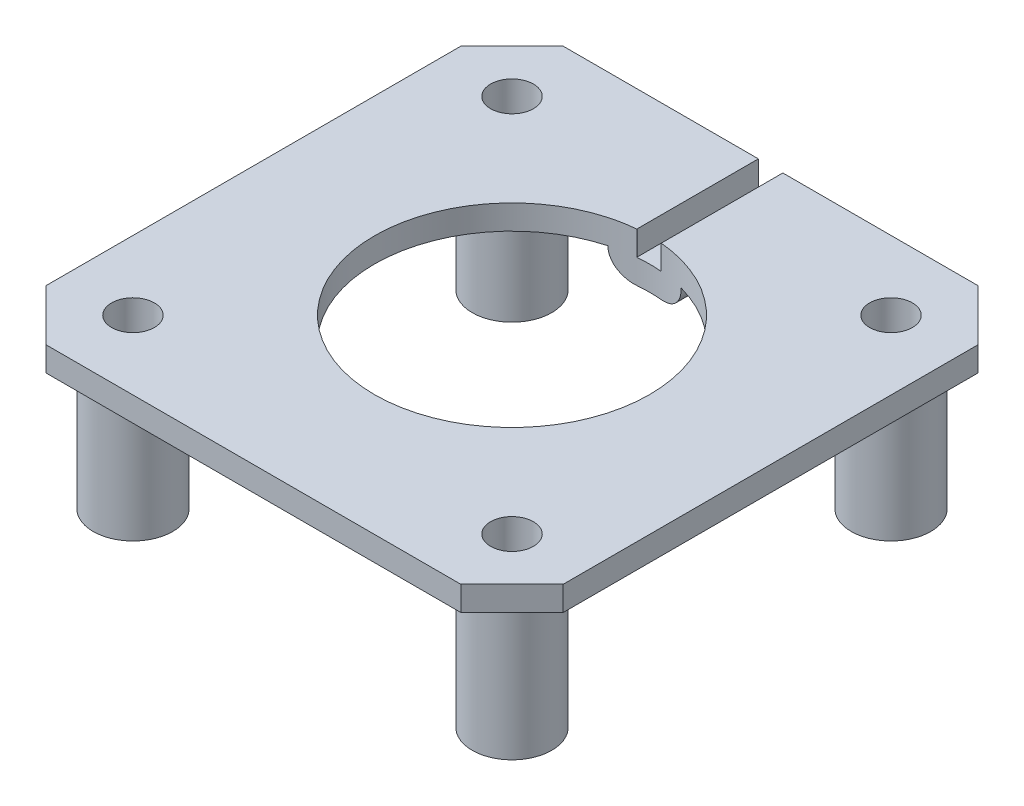
from build123d import *
from build123d.topology import SkipClean

# Parameters (mm, degrees)
SKETCH1_R               = 3.25
BOSS_EXTRUDE1_DEPTH     = 13.7
SKETCH2_W               = 42.3
SKETCH2_H               = 42.3
SKETCH2_R               = 11.25
BOSS_EXTRUDE2_DEPTH     = 2
CUT_EXTRUDE1_DEPTH      = 33.898860163
SKETCH4_R               = 1.75
CUT_EXTRUDE2_DEPTH      = 33.898860163
MIRROR6_COPY_1_SKETCH_R = 1.75
MIRROR6_COPY_1_DEPTH    = 33.898860163
BOSS_EXTRUDE3_DEPTH     = 2
CUT_EXTRUDE3_DEPTH      = 2
FILLET1_R               = 2


with BuildPart() as part:
    # Sketch1 → Boss-Extrude1 (new body)
    with BuildSketch(Plane(origin=(0, 0, 0), x_dir=(1, 0, 0), z_dir=(0, 1, 0))):
        with Locations(Location((-15.5, 15.5, 0), (0, 0, 270))):
            Circle(SKETCH1_R)
    extrude(amount=BOSS_EXTRUDE1_DEPTH)


with BuildPart() as body_2:
    # Mirror2: mirrored copy
    add(part.part.mirror(Plane(origin=(0, 0, 0), x_dir=(0, 0, 1), z_dir=(1, 0, 0))))


with BuildPart() as body_3:
    # Mirror3: mirrored copy
    add(part.part.mirror(Plane.XY))


with BuildPart() as body_4:
    # Mirror3 2: mirrored copy
    add(body_2.part.mirror(Plane.XY))


with BuildPart() as part_1:
    add(part.part)

    add(body_2.part)  # Boss-Extrude2 merges body 2

    add(body_3.part)  # Boss-Extrude2 merges body 3

    add(body_4.part)  # Boss-Extrude2 merges body 4
    # Sketch2 → Boss-Extrude2 (add)
    with BuildSketch(Plane(origin=(0, 13.7, 0), x_dir=(1, 0, 0), z_dir=(0, 1, 0))):
        Rectangle(SKETCH2_W, SKETCH2_H)
        with Locations(Location((0, 0, 0), (0, 0, 270))):
            Circle(SKETCH2_R, mode=Mode.SUBTRACT)
    extrude(amount=-BOSS_EXTRUDE2_DEPTH)

    # Sketch3 → Cut-Extrude1 (cut, through all)
    with BuildSketch(Plane(origin=(0, 13.7, 0), x_dir=(1, 0, 0), z_dir=(0, 1, 0))):
        Polygon((-16.963055506, 21.15), (-21.15, 16.963055506), (-21.15, 21.15), align=None)
        Polygon((16.963055506, -21.15), (21.15, -16.963055506), (21.15, -21.15), align=None)
    cut_extrude1 = extrude(amount=-CUT_EXTRUDE1_DEPTH, mode=Mode.SUBTRACT)

    # Mirror4: Cut-Extrude1 across plane
    add(cut_extrude1.mirror(Plane.XY), mode=Mode.SUBTRACT)

    # Sketch4 → Cut-Extrude2 (cut, through all)
    with BuildSketch(Plane.XZ):
        with Locations(Location((15.5, -15.5, 0), (0, 0, 270))):
            Circle(SKETCH4_R)
    cut_extrude2 = extrude(amount=-CUT_EXTRUDE2_DEPTH, mode=Mode.SUBTRACT)

    # Mirror5: Cut-Extrude2 across plane
    add(cut_extrude2.mirror(Plane(origin=(0, 0, 0), x_dir=(0, 0, 1), z_dir=(1, 0, 0))), mode=Mode.SUBTRACT)

    # Mirror6: Cut-Extrude2 across plane
    add(cut_extrude2.mirror(Plane.XY), mode=Mode.SUBTRACT)

    # Mirror6 copy 1 sketch → Mirror6 copy 1 (cut, through all)
    with BuildSketch(Plane(origin=(0, 0, 0), x_dir=(-1, 0, 0), z_dir=(0, -1, 0))):
        with Locations(Location((15.5, -15.5, 0), (0, 0, 270))):
            Circle(MIRROR6_COPY_1_SKETCH_R)
    extrude(amount=-MIRROR6_COPY_1_DEPTH, mode=Mode.SUBTRACT)

    # Sketch6 → Boss-Extrude3 (add)
    with SkipClean():  # the faces are left unmerged after this step: merging them gives an invalid solid
        with BuildSketch(Plane.XZ.offset(-11.7)):
            with BuildLine():
                Line((-3, -21.15), (-3, -10.842624221))
                ThreePointArc((-3, -10.842624221), (0, -11.25), (3, -10.842624221))
                Line((3, -10.842624221), (3, -21.15))
                Line((3, -21.15), (-3, -21.15))
            make_face()
        extrude(amount=BOSS_EXTRUDE3_DEPTH)

    # Sketch7 → Cut-Extrude3 (cut)
    with SkipClean():  # the faces are left unmerged after this step: merging them gives an invalid solid
        with BuildSketch(Plane(origin=(0, 13.7, 0), x_dir=(1, 0, 0), z_dir=(0, 1, 0))):
            with BuildLine():
                Line((-1, 11.25), (-1, 21.15))
                ThreePointArc((-1, 21.15), (0, 22.15), (1, 21.15))
                Line((1, 21.15), (1, 11.25))
                ThreePointArc((1, 11.25), (0, 10.25), (-1, 11.25))
            make_face()
        extrude(amount=-CUT_EXTRUDE3_DEPTH, mode=Mode.SUBTRACT)

    # Fillet1
    fillet1_edges = [part_1.edges().sort_by_distance(p)[0] for p in [
        (3, 9.7, -15.996312111),
        (-3, 9.7, -15.996312111),
    ]]
    fillet(fillet1_edges, radius=FILLET1_R - 0.0001)  # a hair under: the kernel refuses the full size


solid = part_1.part
